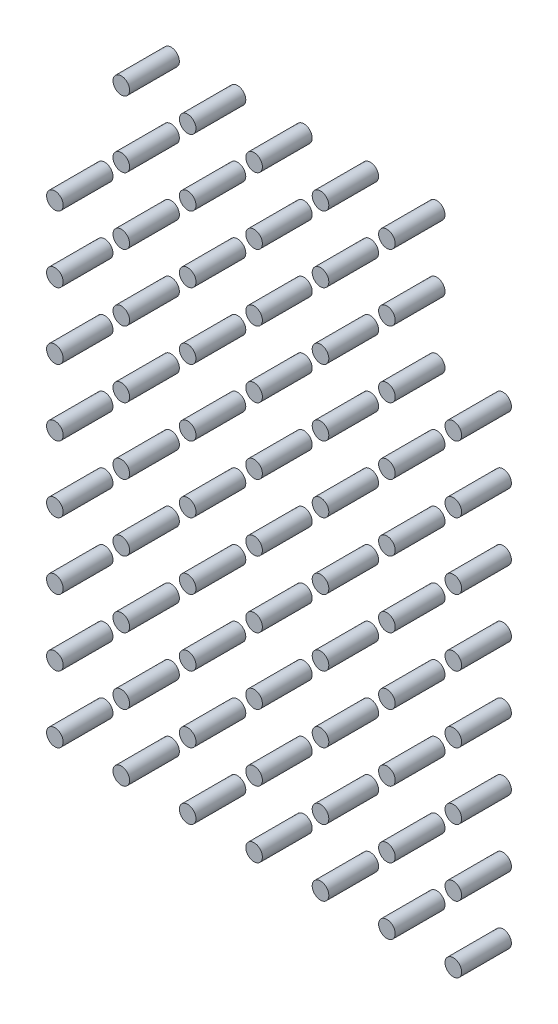
from build123d import *

# Parameters (mm, degrees)
SKETCH_2_R               = 0.25
EXTRUDE_2_DEPTH          = 1.5
PATTERN_LINEAR_1_COUNT   = 8
PATTERN_LINEAR_1_PITCH   = 2
PATTERN_LINEAR_1_2_COUNT = 8
PATTERN_LINEAR_1_2_PITCH = 2


with BuildPart() as part:
    # 草图2 → 凸台-拉伸2 (new body)
    with BuildSketch(Plane.XY):
        with Locations((-9.975090359, 7.0637984)):
            Circle(SKETCH_2_R)
    extrude(amount=EXTRUDE_2_DEPTH)


with BuildPart() as pattern_linear_1_1:
    # 阵列(线性)1: pattern copy
    add(part.part.moved(Location(Vector(1, 0, 0) * (1 * PATTERN_LINEAR_1_PITCH))))


with BuildPart() as pattern_linear_1_2:
    # 阵列(线性)1: pattern copy
    add(part.part.moved(Location(Vector(1, 0, 0) * (2 * PATTERN_LINEAR_1_PITCH))))


with BuildPart() as pattern_linear_1_3:
    # 阵列(线性)1: pattern copy
    add(part.part.moved(Location(Vector(1, 0, 0) * (3 * PATTERN_LINEAR_1_PITCH))))


with BuildPart() as pattern_linear_1_4:
    # 阵列(线性)1: pattern copy
    add(part.part.moved(Location(Vector(1, 0, 0) * (4 * PATTERN_LINEAR_1_PITCH))))


with BuildPart() as pattern_linear_1_5:
    # 阵列(线性)1: pattern copy
    add(part.part.moved(Location(Vector(1, 0, 0) * (5 * PATTERN_LINEAR_1_PITCH))))


with BuildPart() as pattern_linear_1_6:
    # 阵列(线性)1: pattern copy
    add(part.part.moved(Location(Vector(1, 0, 0) * (6 * PATTERN_LINEAR_1_PITCH))))


with BuildPart() as pattern_linear_1_7:
    # 阵列(线性)1: pattern copy
    add(part.part.moved(Location(Vector(1, 0, 0) * (7 * PATTERN_LINEAR_1_PITCH))))


with BuildPart() as pattern_linear_1_2_1:
    # Pattern Linear 1 2: pattern copy
    add(part.part.moved(Location(Vector(0, -1, 0) * (1 * PATTERN_LINEAR_1_2_PITCH))))


with BuildPart() as pattern_linear_1_2_2:
    # Pattern Linear 1 2: pattern copy
    add(part.part.moved(Location(Vector(0, -1, 0) * (2 * PATTERN_LINEAR_1_2_PITCH))))


with BuildPart() as pattern_linear_1_2_3:
    # Pattern Linear 1 2: pattern copy
    add(part.part.moved(Location(Vector(0, -1, 0) * (3 * PATTERN_LINEAR_1_2_PITCH))))


with BuildPart() as pattern_linear_1_2_4:
    # Pattern Linear 1 2: pattern copy
    add(part.part.moved(Location(Vector(0, -1, 0) * (4 * PATTERN_LINEAR_1_2_PITCH))))


with BuildPart() as pattern_linear_1_2_5:
    # Pattern Linear 1 2: pattern copy
    add(part.part.moved(Location(Vector(0, -1, 0) * (5 * PATTERN_LINEAR_1_2_PITCH))))


with BuildPart() as pattern_linear_1_2_6:
    # Pattern Linear 1 2: pattern copy
    add(part.part.moved(Location(Vector(0, -1, 0) * (6 * PATTERN_LINEAR_1_2_PITCH))))


with BuildPart() as pattern_linear_1_2_7:
    # Pattern Linear 1 2: pattern copy
    add(part.part.moved(Location(Vector(0, -1, 0) * (7 * PATTERN_LINEAR_1_2_PITCH))))


with BuildPart() as pattern_linear_1_2_8:
    # Pattern Linear 1 2: pattern copy
    add(pattern_linear_1_1.part.moved(Location(Vector(0, -1, 0) * (1 * PATTERN_LINEAR_1_2_PITCH))))


with BuildPart() as pattern_linear_1_2_9:
    # Pattern Linear 1 2: pattern copy
    add(pattern_linear_1_1.part.moved(Location(Vector(0, -1, 0) * (2 * PATTERN_LINEAR_1_2_PITCH))))


with BuildPart() as pattern_linear_1_2_10:
    # Pattern Linear 1 2: pattern copy
    add(pattern_linear_1_1.part.moved(Location(Vector(0, -1, 0) * (3 * PATTERN_LINEAR_1_2_PITCH))))


with BuildPart() as pattern_linear_1_2_11:
    # Pattern Linear 1 2: pattern copy
    add(pattern_linear_1_1.part.moved(Location(Vector(0, -1, 0) * (4 * PATTERN_LINEAR_1_2_PITCH))))


with BuildPart() as pattern_linear_1_2_12:
    # Pattern Linear 1 2: pattern copy
    add(pattern_linear_1_1.part.moved(Location(Vector(0, -1, 0) * (5 * PATTERN_LINEAR_1_2_PITCH))))


with BuildPart() as pattern_linear_1_2_13:
    # Pattern Linear 1 2: pattern copy
    add(pattern_linear_1_1.part.moved(Location(Vector(0, -1, 0) * (6 * PATTERN_LINEAR_1_2_PITCH))))


with BuildPart() as pattern_linear_1_2_14:
    # Pattern Linear 1 2: pattern copy
    add(pattern_linear_1_1.part.moved(Location(Vector(0, -1, 0) * (7 * PATTERN_LINEAR_1_2_PITCH))))


with BuildPart() as pattern_linear_1_2_15:
    # Pattern Linear 1 2: pattern copy
    add(pattern_linear_1_2.part.moved(Location(Vector(0, -1, 0) * (1 * PATTERN_LINEAR_1_2_PITCH))))


with BuildPart() as pattern_linear_1_2_16:
    # Pattern Linear 1 2: pattern copy
    add(pattern_linear_1_2.part.moved(Location(Vector(0, -1, 0) * (2 * PATTERN_LINEAR_1_2_PITCH))))


with BuildPart() as pattern_linear_1_2_17:
    # Pattern Linear 1 2: pattern copy
    add(pattern_linear_1_2.part.moved(Location(Vector(0, -1, 0) * (3 * PATTERN_LINEAR_1_2_PITCH))))


with BuildPart() as pattern_linear_1_2_18:
    # Pattern Linear 1 2: pattern copy
    add(pattern_linear_1_2.part.moved(Location(Vector(0, -1, 0) * (4 * PATTERN_LINEAR_1_2_PITCH))))


with BuildPart() as pattern_linear_1_2_19:
    # Pattern Linear 1 2: pattern copy
    add(pattern_linear_1_2.part.moved(Location(Vector(0, -1, 0) * (5 * PATTERN_LINEAR_1_2_PITCH))))


with BuildPart() as pattern_linear_1_2_20:
    # Pattern Linear 1 2: pattern copy
    add(pattern_linear_1_2.part.moved(Location(Vector(0, -1, 0) * (6 * PATTERN_LINEAR_1_2_PITCH))))


with BuildPart() as pattern_linear_1_2_21:
    # Pattern Linear 1 2: pattern copy
    add(pattern_linear_1_2.part.moved(Location(Vector(0, -1, 0) * (7 * PATTERN_LINEAR_1_2_PITCH))))


with BuildPart() as pattern_linear_1_2_22:
    # Pattern Linear 1 2: pattern copy
    add(pattern_linear_1_3.part.moved(Location(Vector(0, -1, 0) * (1 * PATTERN_LINEAR_1_2_PITCH))))


with BuildPart() as pattern_linear_1_2_23:
    # Pattern Linear 1 2: pattern copy
    add(pattern_linear_1_3.part.moved(Location(Vector(0, -1, 0) * (2 * PATTERN_LINEAR_1_2_PITCH))))


with BuildPart() as pattern_linear_1_2_24:
    # Pattern Linear 1 2: pattern copy
    add(pattern_linear_1_3.part.moved(Location(Vector(0, -1, 0) * (3 * PATTERN_LINEAR_1_2_PITCH))))


with BuildPart() as pattern_linear_1_2_25:
    # Pattern Linear 1 2: pattern copy
    add(pattern_linear_1_3.part.moved(Location(Vector(0, -1, 0) * (4 * PATTERN_LINEAR_1_2_PITCH))))


with BuildPart() as pattern_linear_1_2_26:
    # Pattern Linear 1 2: pattern copy
    add(pattern_linear_1_3.part.moved(Location(Vector(0, -1, 0) * (5 * PATTERN_LINEAR_1_2_PITCH))))


with BuildPart() as pattern_linear_1_2_27:
    # Pattern Linear 1 2: pattern copy
    add(pattern_linear_1_3.part.moved(Location(Vector(0, -1, 0) * (6 * PATTERN_LINEAR_1_2_PITCH))))


with BuildPart() as pattern_linear_1_2_28:
    # Pattern Linear 1 2: pattern copy
    add(pattern_linear_1_3.part.moved(Location(Vector(0, -1, 0) * (7 * PATTERN_LINEAR_1_2_PITCH))))


with BuildPart() as pattern_linear_1_2_29:
    # Pattern Linear 1 2: pattern copy
    add(pattern_linear_1_4.part.moved(Location(Vector(0, -1, 0) * (1 * PATTERN_LINEAR_1_2_PITCH))))


with BuildPart() as pattern_linear_1_2_30:
    # Pattern Linear 1 2: pattern copy
    add(pattern_linear_1_4.part.moved(Location(Vector(0, -1, 0) * (2 * PATTERN_LINEAR_1_2_PITCH))))


with BuildPart() as pattern_linear_1_2_31:
    # Pattern Linear 1 2: pattern copy
    add(pattern_linear_1_4.part.moved(Location(Vector(0, -1, 0) * (3 * PATTERN_LINEAR_1_2_PITCH))))


with BuildPart() as pattern_linear_1_2_32:
    # Pattern Linear 1 2: pattern copy
    add(pattern_linear_1_4.part.moved(Location(Vector(0, -1, 0) * (4 * PATTERN_LINEAR_1_2_PITCH))))


with BuildPart() as pattern_linear_1_2_33:
    # Pattern Linear 1 2: pattern copy
    add(pattern_linear_1_4.part.moved(Location(Vector(0, -1, 0) * (5 * PATTERN_LINEAR_1_2_PITCH))))


with BuildPart() as pattern_linear_1_2_34:
    # Pattern Linear 1 2: pattern copy
    add(pattern_linear_1_4.part.moved(Location(Vector(0, -1, 0) * (6 * PATTERN_LINEAR_1_2_PITCH))))


with BuildPart() as pattern_linear_1_2_35:
    # Pattern Linear 1 2: pattern copy
    add(pattern_linear_1_4.part.moved(Location(Vector(0, -1, 0) * (7 * PATTERN_LINEAR_1_2_PITCH))))


with BuildPart() as pattern_linear_1_2_36:
    # Pattern Linear 1 2: pattern copy
    add(pattern_linear_1_5.part.moved(Location(Vector(0, -1, 0) * (1 * PATTERN_LINEAR_1_2_PITCH))))


with BuildPart() as pattern_linear_1_2_37:
    # Pattern Linear 1 2: pattern copy
    add(pattern_linear_1_5.part.moved(Location(Vector(0, -1, 0) * (2 * PATTERN_LINEAR_1_2_PITCH))))


with BuildPart() as pattern_linear_1_2_38:
    # Pattern Linear 1 2: pattern copy
    add(pattern_linear_1_5.part.moved(Location(Vector(0, -1, 0) * (3 * PATTERN_LINEAR_1_2_PITCH))))


with BuildPart() as pattern_linear_1_2_39:
    # Pattern Linear 1 2: pattern copy
    add(pattern_linear_1_5.part.moved(Location(Vector(0, -1, 0) * (4 * PATTERN_LINEAR_1_2_PITCH))))


with BuildPart() as pattern_linear_1_2_40:
    # Pattern Linear 1 2: pattern copy
    add(pattern_linear_1_5.part.moved(Location(Vector(0, -1, 0) * (5 * PATTERN_LINEAR_1_2_PITCH))))


with BuildPart() as pattern_linear_1_2_41:
    # Pattern Linear 1 2: pattern copy
    add(pattern_linear_1_5.part.moved(Location(Vector(0, -1, 0) * (6 * PATTERN_LINEAR_1_2_PITCH))))


with BuildPart() as pattern_linear_1_2_42:
    # Pattern Linear 1 2: pattern copy
    add(pattern_linear_1_5.part.moved(Location(Vector(0, -1, 0) * (7 * PATTERN_LINEAR_1_2_PITCH))))


with BuildPart() as pattern_linear_1_2_43:
    # Pattern Linear 1 2: pattern copy
    add(pattern_linear_1_6.part.moved(Location(Vector(0, -1, 0) * (1 * PATTERN_LINEAR_1_2_PITCH))))


with BuildPart() as pattern_linear_1_2_44:
    # Pattern Linear 1 2: pattern copy
    add(pattern_linear_1_6.part.moved(Location(Vector(0, -1, 0) * (2 * PATTERN_LINEAR_1_2_PITCH))))


with BuildPart() as pattern_linear_1_2_45:
    # Pattern Linear 1 2: pattern copy
    add(pattern_linear_1_6.part.moved(Location(Vector(0, -1, 0) * (3 * PATTERN_LINEAR_1_2_PITCH))))


with BuildPart() as pattern_linear_1_2_46:
    # Pattern Linear 1 2: pattern copy
    add(pattern_linear_1_6.part.moved(Location(Vector(0, -1, 0) * (4 * PATTERN_LINEAR_1_2_PITCH))))


with BuildPart() as pattern_linear_1_2_47:
    # Pattern Linear 1 2: pattern copy
    add(pattern_linear_1_6.part.moved(Location(Vector(0, -1, 0) * (5 * PATTERN_LINEAR_1_2_PITCH))))


with BuildPart() as pattern_linear_1_2_48:
    # Pattern Linear 1 2: pattern copy
    add(pattern_linear_1_6.part.moved(Location(Vector(0, -1, 0) * (6 * PATTERN_LINEAR_1_2_PITCH))))


with BuildPart() as pattern_linear_1_2_49:
    # Pattern Linear 1 2: pattern copy
    add(pattern_linear_1_6.part.moved(Location(Vector(0, -1, 0) * (7 * PATTERN_LINEAR_1_2_PITCH))))


with BuildPart() as pattern_linear_1_2_50:
    # Pattern Linear 1 2: pattern copy
    add(pattern_linear_1_7.part.moved(Location(Vector(0, -1, 0) * (1 * PATTERN_LINEAR_1_2_PITCH))))


with BuildPart() as pattern_linear_1_2_51:
    # Pattern Linear 1 2: pattern copy
    add(pattern_linear_1_7.part.moved(Location(Vector(0, -1, 0) * (2 * PATTERN_LINEAR_1_2_PITCH))))


with BuildPart() as pattern_linear_1_2_52:
    # Pattern Linear 1 2: pattern copy
    add(pattern_linear_1_7.part.moved(Location(Vector(0, -1, 0) * (3 * PATTERN_LINEAR_1_2_PITCH))))


with BuildPart() as pattern_linear_1_2_53:
    # Pattern Linear 1 2: pattern copy
    add(pattern_linear_1_7.part.moved(Location(Vector(0, -1, 0) * (4 * PATTERN_LINEAR_1_2_PITCH))))


with BuildPart() as pattern_linear_1_2_54:
    # Pattern Linear 1 2: pattern copy
    add(pattern_linear_1_7.part.moved(Location(Vector(0, -1, 0) * (5 * PATTERN_LINEAR_1_2_PITCH))))


with BuildPart() as pattern_linear_1_2_55:
    # Pattern Linear 1 2: pattern copy
    add(pattern_linear_1_7.part.moved(Location(Vector(0, -1, 0) * (6 * PATTERN_LINEAR_1_2_PITCH))))


with BuildPart() as pattern_linear_1_2_56:
    # Pattern Linear 1 2: pattern copy
    add(pattern_linear_1_7.part.moved(Location(Vector(0, -1, 0) * (7 * PATTERN_LINEAR_1_2_PITCH))))


with BuildPart() as body_65:
    # 填充阵列1: read off the stored shape, not the designer's step
    # 填充阵列1: copy of 阵列(线性)1 2_56
    add(pattern_linear_1_2_56.part.moved(Location((-2, 16, 0))))


with BuildPart() as body_66:
    # Other 1 2: copy of 阵列(线性)1 2_56
    add(pattern_linear_1_2_56.part.moved(Location((-2, 18, 0))))


with BuildPart() as body_67:
    # Other 1 3: copy of 阵列(线性)1 2_56
    add(pattern_linear_1_2_56.part.moved(Location((-4, 16, 0))))


with BuildPart() as body_68:
    # Other 1 4: copy of 阵列(线性)1 2_56
    add(pattern_linear_1_2_56.part.moved(Location((-4, 18, 0))))


with BuildPart() as body_69:
    # Other 1 5: copy of 阵列(线性)1 2_56
    add(pattern_linear_1_2_56.part.moved(Location((-6, 16, 0))))


with BuildPart() as body_70:
    # Other 1 6: copy of 阵列(线性)1 2_56
    add(pattern_linear_1_2_56.part.moved(Location((-6, 18, 0))))


with BuildPart() as body_71:
    # Other 1 7: copy of 阵列(线性)1 2_56
    add(pattern_linear_1_2_56.part.moved(Location((-8, 16, 0))))


with BuildPart() as body_72:
    # Other 1 8: copy of 阵列(线性)1 2_56
    add(pattern_linear_1_2_56.part.moved(Location((-8, 18, 0))))


with BuildPart() as body_73:
    # Other 1 9: copy of 阵列(线性)1 2_56
    add(pattern_linear_1_2_56.part.moved(Location((-10, 16, 0))))


with BuildPart() as body_74:
    # Other 1 10: copy of 阵列(线性)1 2_56
    add(pattern_linear_1_2_56.part.moved(Location((-10, 18, 0))))


with BuildPart() as body_75:
    # Other 1 11: copy of 阵列(线性)1 2_56
    add(pattern_linear_1_2_56.part.moved(Location((-12, 16, 0))))


with BuildPart() as body_76:
    # Other 1 12: copy of 阵列(线性)1 2_56
    add(pattern_linear_1_2_56.part.moved(Location((0, 16, 0))))


with BuildPart() as body_77:
    # Other 1 13: copy of 阵列(线性)1 2_56
    add(pattern_linear_1_2_56.part.moved(Location((0, 18, 0))))


with BuildPart() as body_78:
    # Other 1 14: copy of 阵列(线性)1 2_56
    add(pattern_linear_1_2_56.part.moved(Location((-2, 20, 0))))


with BuildPart() as body_79:
    # Other 1 15: copy of 阵列(线性)1 2_56
    add(pattern_linear_1_2_56.part.moved(Location((-4, 20, 0))))


with BuildPart() as body_80:
    # Other 1 16: copy of 阵列(线性)1 2_56
    add(pattern_linear_1_2_56.part.moved(Location((-6, 22, 0))))


with BuildPart() as body_81:
    # Other 1 17: copy of 阵列(线性)1 2_56
    add(pattern_linear_1_2_56.part.moved(Location((-6, 20, 0))))


with BuildPart() as body_82:
    # Other 1 18: copy of 阵列(线性)1 2_56
    add(pattern_linear_1_2_56.part.moved(Location((-8, 20, 0))))


with BuildPart() as body_83:
    # Other 1 19: copy of 阵列(线性)1 2_56
    add(pattern_linear_1_2_56.part.moved(Location((-10, 20, 0))))


with BuildPart() as body_84:
    # Other 1 20: copy of 阵列(线性)1 2_56
    add(pattern_linear_1_2_56.part.moved(Location((-12, 18, 0))))


with BuildPart() as body_85:
    # Other 1 21: copy of 阵列(线性)1 2_56
    add(pattern_linear_1_2_56.part.moved(Location((-14, 16, 0))))


with BuildPart() as body_86:
    # Other 1 22: copy of 阵列(线性)1 2_56
    add(pattern_linear_1_2_56.part.moved(Location((-14, 18, 0))))


with BuildPart() as body_87:
    # Other 1 23: copy of 阵列(线性)1 2_56
    add(pattern_linear_1_2_56.part.moved(Location((-12, 20, 0))))


with BuildPart() as body_88:
    # Other 1 24: copy of 阵列(线性)1 2_56
    add(pattern_linear_1_2_56.part.moved(Location((-8, 22, 0))))


with BuildPart() as body_89:
    # Other 1 25: copy of 阵列(线性)1 2_56
    add(pattern_linear_1_2_56.part.moved(Location((-4, 22, 0))))


with BuildPart() as body_90:
    # Other 1 26: copy of 阵列(线性)1 2_56
    add(pattern_linear_1_2_56.part.moved(Location((-10, 22, 0))))


solid = Compound([pattern_linear_1_1.part, pattern_linear_1_2.part, pattern_linear_1_3.part, pattern_linear_1_4.part, pattern_linear_1_5.part, pattern_linear_1_6.part, pattern_linear_1_7.part, pattern_linear_1_2_8.part, pattern_linear_1_2_9.part, pattern_linear_1_2_10.part, pattern_linear_1_2_11.part, pattern_linear_1_2_12.part, pattern_linear_1_2_13.part, pattern_linear_1_2_14.part, pattern_linear_1_2_15.part, pattern_linear_1_2_16.part, pattern_linear_1_2_17.part, pattern_linear_1_2_18.part, pattern_linear_1_2_19.part, pattern_linear_1_2_20.part, pattern_linear_1_2_21.part, pattern_linear_1_2_22.part, pattern_linear_1_2_23.part, pattern_linear_1_2_24.part, pattern_linear_1_2_25.part, pattern_linear_1_2_26.part, pattern_linear_1_2_27.part, pattern_linear_1_2_28.part, pattern_linear_1_2_29.part, pattern_linear_1_2_30.part, pattern_linear_1_2_31.part, pattern_linear_1_2_32.part, pattern_linear_1_2_33.part, pattern_linear_1_2_34.part, pattern_linear_1_2_35.part, pattern_linear_1_2_36.part, pattern_linear_1_2_37.part, pattern_linear_1_2_38.part, pattern_linear_1_2_39.part, pattern_linear_1_2_40.part, pattern_linear_1_2_41.part, pattern_linear_1_2_42.part, pattern_linear_1_2_43.part, pattern_linear_1_2_44.part, pattern_linear_1_2_45.part, pattern_linear_1_2_46.part, pattern_linear_1_2_47.part, pattern_linear_1_2_48.part, pattern_linear_1_2_49.part, pattern_linear_1_2_50.part, pattern_linear_1_2_51.part, pattern_linear_1_2_52.part, pattern_linear_1_2_53.part, pattern_linear_1_2_54.part, pattern_linear_1_2_55.part, pattern_linear_1_2_56.part, body_65.part, body_66.part, body_67.part, body_68.part, body_69.part, body_70.part, body_71.part, body_72.part, body_73.part, body_74.part])
